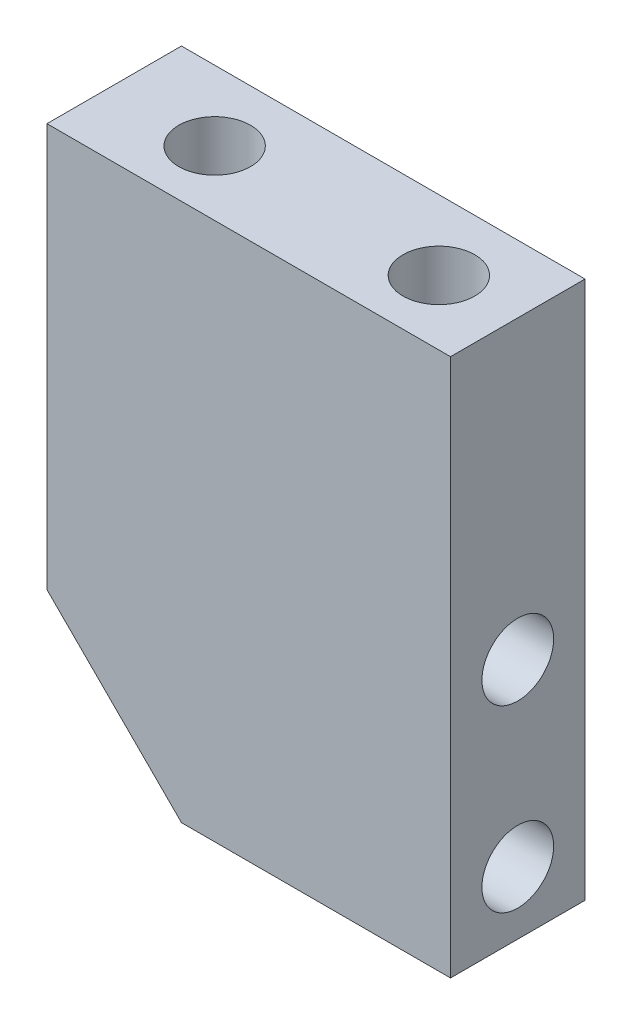
from build123d import *

# Parameters (mm, degrees)
SZKIC1_W                    = 45
SZKIC1_H                    = 60
DODANIE_WYCI_GNI_CIE1_DEPTH = 15
SZKIC3_R                    = 4
WYTNIJ_WYCI_GNI_CIE1_DEPTH  = 15
SFAZOWANIE1_SIZE            = 15
SZKIC4_R                    = 4
WYTNIJ_WYCI_GNI_CIE2_DEPTH  = 25


with BuildPart() as part:
    # Szkic1 → Dodanie-wyciągnięcie1 (new body)
    with BuildSketch(Plane.XY):
        Rectangle(SZKIC1_W, SZKIC1_H)
    extrude(amount=DODANIE_WYCI_GNI_CIE1_DEPTH)

    # Szkic3 → Wytnij-wyciągnięcie1 (cut)
    with BuildSketch(Plane(origin=(0, 30, 0), x_dir=(1, 0, 0), z_dir=(0, 1, 0))):
        with Locations((14, -7.8)):
            Circle(SZKIC3_R)
        with Locations((-11, -7.8)):
            Circle(SZKIC3_R)
    extrude(amount=-WYTNIJ_WYCI_GNI_CIE1_DEPTH, mode=Mode.SUBTRACT)

    # Sfazowanie1
    sfazowanie1_edges = [part.edges().sort_by_distance(p)[0] for p in [
        (-22.5, -30, 7.5),
    ]]
    chamfer(sfazowanie1_edges, length=SFAZOWANIE1_SIZE)

    # Szkic4 → Wytnij-wyciągnięcie2 (cut)
    with BuildSketch(Plane(origin=(22.5, 0, 0), x_dir=(0, 0, -1), z_dir=(1, 0, 0))):
        with Locations((-7.5, -23)):
            Circle(SZKIC4_R)
        with Locations((-7.5, -3)):
            Circle(SZKIC4_R)
    extrude(amount=-WYTNIJ_WYCI_GNI_CIE2_DEPTH, mode=Mode.SUBTRACT)


solid = part.part
